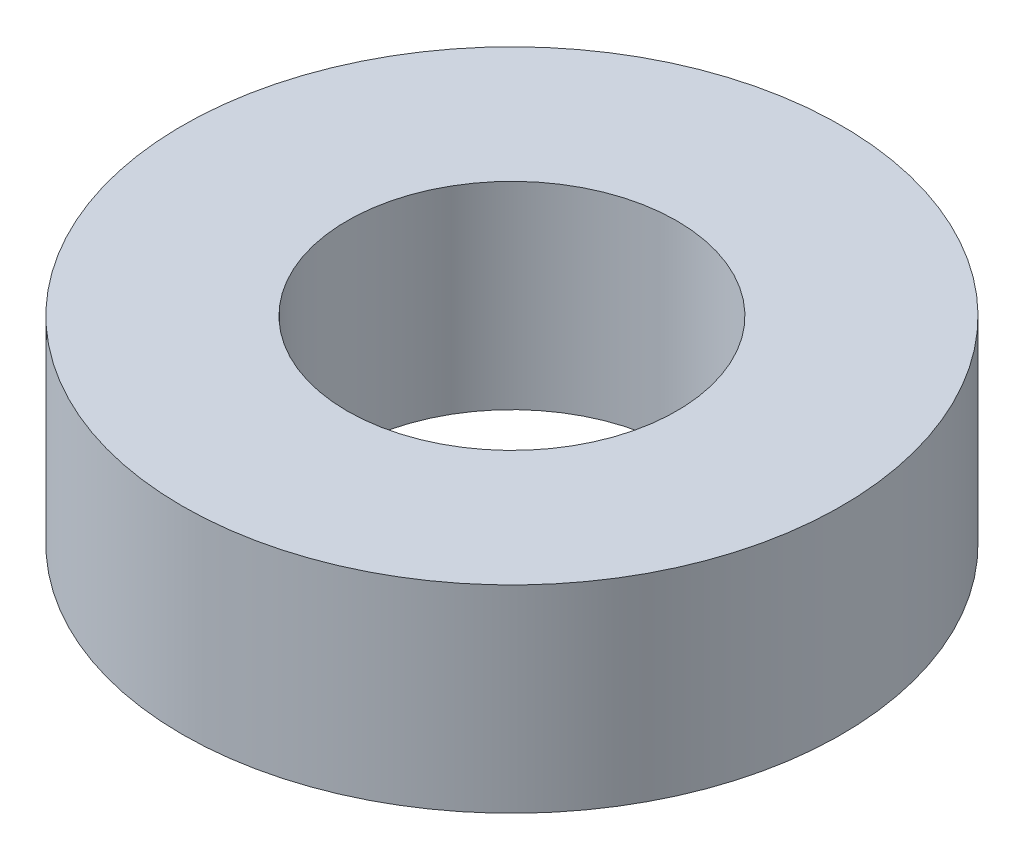
from build123d import *

# Parameters (mm, degrees)
SKETCH1_R           = 25
BOSS_EXTRUDE1_DEPTH = 15
SKETCH2_R           = 12.5
CUT_EXTRUDE1_DEPTH  = 39.405728739


with BuildPart() as part:
    # Sketch1 → Boss-Extrude1 (new body)
    with BuildSketch(Plane(origin=(0, 0, 0), x_dir=(1, 0, 0), z_dir=(0, 1, 0))):
        Circle(SKETCH1_R)
    extrude(amount=BOSS_EXTRUDE1_DEPTH)

    # Sketch2 → Cut-Extrude1 (cut, through all)
    with BuildSketch(Plane(origin=(0, 0, 0), x_dir=(1, 0, 0), z_dir=(0, 1, 0))):
        Circle(SKETCH2_R)
    extrude(amount=CUT_EXTRUDE1_DEPTH, mode=Mode.SUBTRACT)


solid = part.part
